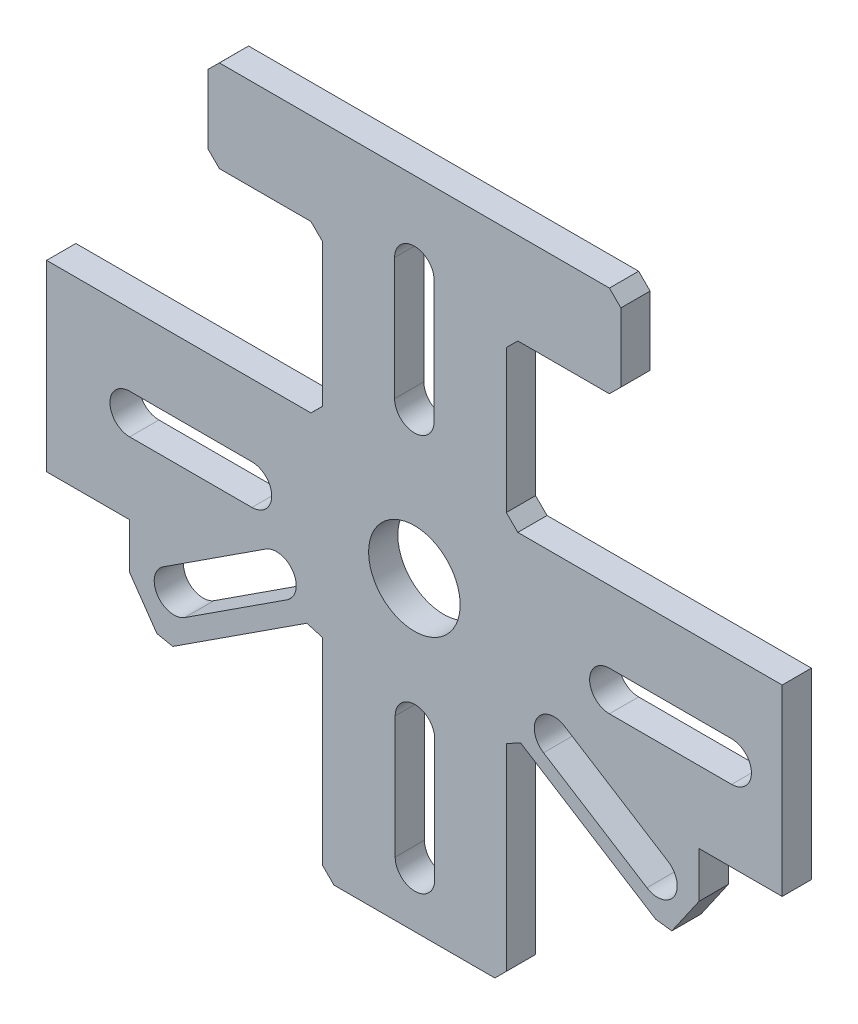
from build123d import *

# Parameters (mm, degrees)
SKETCH1_R           = 4.98
BOSS_EXTRUDE1_DEPTH = 3.18


with BuildPart() as part:
    # Sketch1 → Boss-Extrude1 (new body)
    with BuildSketch(Plane.XY):
        Polygon((-21.21, 37.952485292), (21.21, 37.952485292), (22.46, 36.707485292), (22.46, 29.237485292), (21.21, 27.992485292), (11.25, 27.992485292), (10, 26.747485292), (10, 11.205), (11.25, 9.96), (40, 9.96), (40, -9.96), (30.96358554, -9.96), (30.96358554, -14.931213625), (28, -19.204177901), (26.249517293, -18.984325009), (11.545017116, -9.71013669), (10, -10.561868522), (10, -32.017665922), (8.75, -33.262665922), (-8.75, -33.262665922), (-10, -32.017665922), (-10, -10.561868522), (-11.693594695, -10.067639821), (-26.268760963, -19.543790027), (-28, -19.204177901), (-30.96358554, -14.931213625), (-30.96358554, -9.96), (-40, -9.96), (-40, 9.96), (-11.25, 9.96), (-10, 11.205), (-10, 26.747485292), (-11.25, 27.992485292), (-21.21, 27.992485292), (-22.46, 29.237485292), (-22.46, 36.707485292), align=None)
        Circle(SKETCH1_R, mode=Mode.SUBTRACT)
        with BuildLine():
            Line((2.15, 29.149784521), (2.15, 15.854433953))
            ThreePointArc((2.15, 15.854433953), (0, 13.704433953), (-2.15, 15.854433953))
            Line((-2.15, 15.854433953), (-2.15, 29.149784521))
            ThreePointArc((-2.15, 29.149784521), (0, 31.299784521), (2.15, 29.149784521))
        make_face(mode=Mode.SUBTRACT)
        with BuildLine():
            Line((2.211707553, -13.99522143), (2.211707553, -27.290571998))
            ThreePointArc((2.211707553, -27.290571998), (0.061707553, -29.440571998), (-2.088292447, -27.290571998))
            Line((-2.088292447, -27.290571998), (-2.088292447, -13.99522143))
            ThreePointArc((-2.088292447, -13.99522143), (0.061707553, -11.84522143), (2.211707553, -13.99522143))
        make_face(mode=Mode.SUBTRACT)
        with BuildLine():
            Line((21.21, 2.15), (34.505350567, 2.15))
            ThreePointArc((34.505350567, 2.15), (36.655350567, 0), (34.505350567, -2.15))
            Line((34.505350567, -2.15), (21.21, -2.15))
            ThreePointArc((21.21, -2.15), (19.06, 0), (21.21, 2.15))
        make_face(mode=Mode.SUBTRACT)
        with BuildLine():
            Line((-30.96358554, 2.15), (-17.668234972, 2.15))
            ThreePointArc((-17.668234972, 2.15), (-15.518234972, 0), (-17.668234972, -2.15))
            Line((-17.668234972, -2.15), (-30.96358554, -2.15))
            ThreePointArc((-30.96358554, -2.15), (-33.11358554, 0), (-30.96358554, 2.15))
        make_face(mode=Mode.SUBTRACT)
        with BuildLine():
            Line((-27.318513144, -12.568606405), (-16.171912397, -5.321562974))
            ThreePointArc((-16.171912397, -5.321562974), (-13.19746394, -5.952162986), (-13.828063952, -8.926611443))
            Line((-13.828063952, -8.926611443), (-24.974664699, -16.173654875))
            ThreePointArc((-24.974664699, -16.173654875), (-27.949113156, -15.543054863), (-27.318513144, -12.568606405))
        make_face(mode=Mode.SUBTRACT)
        with BuildLine():
            Line((16.341169665, -5.760233516), (27.58668067, -12.852823237))
            ThreePointArc((27.58668067, -12.852823237), (28.258252338, -15.818289725), (25.29278585, -16.489861394))
            Line((25.29278585, -16.489861394), (14.047274845, -9.397271673))
            ThreePointArc((14.047274845, -9.397271673), (13.375703176, -6.431805185), (16.341169665, -5.760233516))
        make_face(mode=Mode.SUBTRACT)
    extrude(amount=BOSS_EXTRUDE1_DEPTH)


solid = part.part
